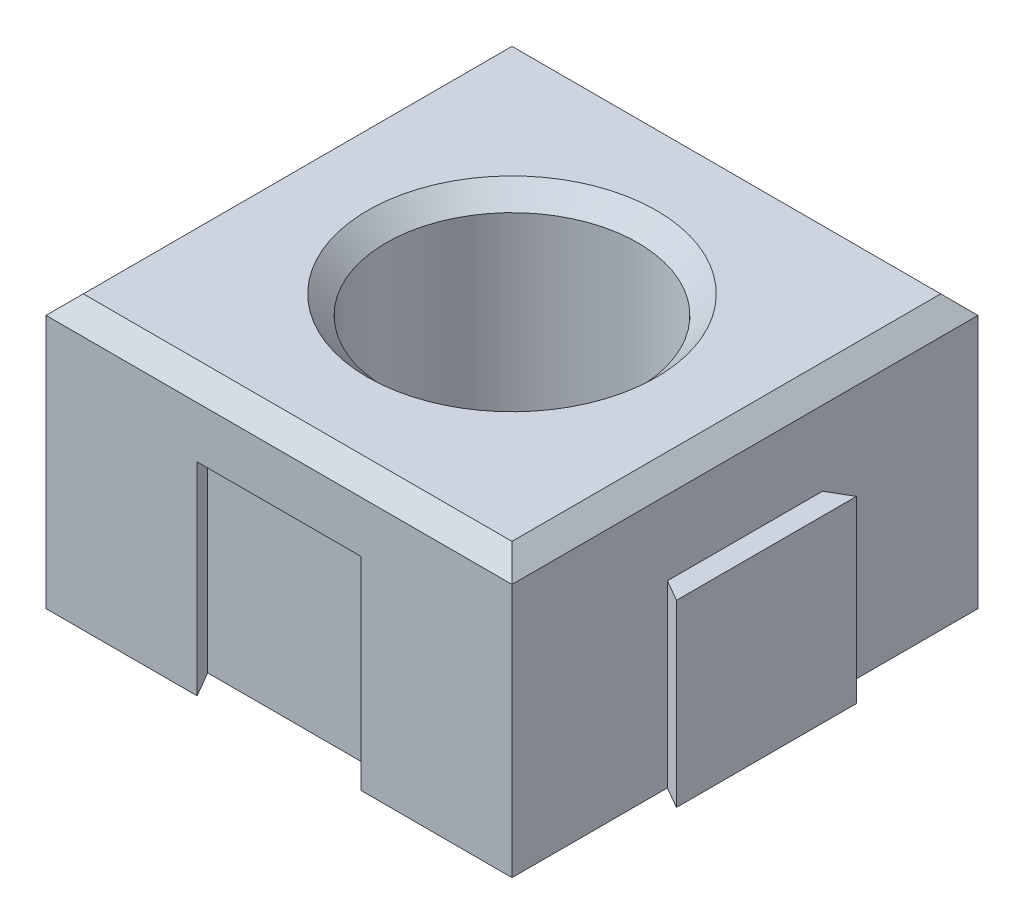
from build123d import *

# Parameters (mm, degrees)
SKETCH1_W           = 50
SKETCH1_H           = 50
BOSS_EXTRUDE1_DEPTH = 30
SKETCH2_R           = 13.5
CUT_EXTRUDE1_DEPTH  = 26
BOSS_EXTRUDE2_DEPTH = 20
BOSS_EXTRUDE3_DEPTH = 20
CUT_EXTRUDE5_DEPTH  = 20
CUT_EXTRUDE6_DEPTH  = 20
CHAMFER1_SIZE       = 2
SKETCH4_R           = 3.1
CUT_EXTRUDE4_DEPTH  = 4
CHAMFER2_SIZE       = 1
CHAMFER3_SIZE       = 0.75
CHAMFER4_SIZE       = 2.5


with BuildPart() as part:
    # Sketch1 → Boss-Extrude1 (new body)
    with BuildSketch(Plane(origin=(0, 0, 0), x_dir=(1, 0, 0), z_dir=(0, 1, 0))):
        with Locations((25, 25)):
            Rectangle(SKETCH1_W, SKETCH1_H)
    extrude(amount=BOSS_EXTRUDE1_DEPTH)

    # Sketch2 → Cut-Extrude1 (cut)
    with BuildSketch(Plane(origin=(0, 30, 0), x_dir=(1, 0, 0), z_dir=(0, 1, 0))):
        with Locations((25, 25)):
            Circle(SKETCH2_R)
    extrude(amount=-CUT_EXTRUDE1_DEPTH, mode=Mode.SUBTRACT)

    # Sketch3 → Boss-Extrude2 (add)
    with BuildSketch(Plane(origin=(0, 0, 0), x_dir=(1, 0, 0), z_dir=(0, 1, 0))):
        Polygon((50, 16.674315781), (50, 33.325684219), (52.3, 34.653589838), (52.3, 15.346410162), align=None)
    extrude(amount=BOSS_EXTRUDE2_DEPTH)

    # Sketch3<3> → Boss-Extrude3 (add)
    with BuildSketch(Plane(origin=(0, 0, 0), x_dir=(1, 0, 0), z_dir=(0, 1, 0))):
        Polygon((33.325684219, 50), (16.674315781, 50), (15.346410162, 52.3), (34.653589838, 52.3), align=None)
    extrude(amount=BOSS_EXTRUDE3_DEPTH)

    # Sketch3<6> → Cut-Extrude5 (cut)
    with BuildSketch(Plane(origin=(0, 0, 0), x_dir=(1, 0, 0), z_dir=(0, 1, 0))):
        Polygon((0, 33.787564435), (2.7, 35.346410162), (2.7, 14.653589838), (0, 16.212435565), align=None)
    extrude(amount=CUT_EXTRUDE5_DEPTH, mode=Mode.SUBTRACT)

    # Sketch3<7> → Cut-Extrude6 (cut)
    with BuildSketch(Plane(origin=(0, 0, 0), x_dir=(1, 0, 0), z_dir=(0, 1, 0))):
        Polygon((16.212435565, 0), (14.653589838, 2.7), (35.346410162, 2.7), (33.787564435, 0), align=None)
    extrude(amount=CUT_EXTRUDE6_DEPTH, mode=Mode.SUBTRACT)

    # Chamfer1
    chamfer1_edges = [part.edges().sort_by_distance(p)[0] for p in [
        (25, 30, -50),
        (50, 30, -25),
        (25, 30, 0),
        (0, 30, -25),
        (11.5, 30, -25),
    ]]
    chamfer(chamfer1_edges, length=CHAMFER1_SIZE)

    # Sketch4 → Cut-Extrude4 (cut)
    with BuildSketch(Plane(origin=(0, 0, 0), x_dir=(1, 0, 0), z_dir=(0, 1, 0))):
        with Locations((12.5, 37.5)):
            Circle(SKETCH4_R)
        with Locations((37.5, 37.5)):
            Circle(SKETCH4_R)
        with Locations((37.5, 12.5)):
            Circle(SKETCH4_R)
        with Locations((12.5, 12.5)):
            Circle(SKETCH4_R)
    extrude(amount=CUT_EXTRUDE4_DEPTH, mode=Mode.SUBTRACT)

    # Chamfer2
    chamfer2_edges = [part.edges().sort_by_distance(p)[0] for p in [
        (34.4, 4, -12.5),
        (9.4, 4, -12.5),
        (9.4, 4, -37.5),
        (34.4, 4, -37.5),
    ]]
    chamfer(chamfer2_edges, length=CHAMFER2_SIZE)

    # Chamfer3
    chamfer3_edges = [part.edges().sort_by_distance(p)[0] for p in [
        (41.893782217, 0, 0),
        (50, 0, -8.33715789),
        (50, 0, -41.66284211),
        (41.66284211, 0, -50),
        (8.33715789, 0, -50),
        (0, 0, -41.893782217),
        (0, 0, -8.106217783),
        (8.106217783, 0, 0),
        (9.4, 0, -37.5),
        (34.4, 0, -37.5),
        (34.4, 0, -12.5),
        (9.4, 0, -12.5),
        (51.15, 0, -16.010362971),
        (52.3, 0, -25),
        (51.15, 0, -33.989637029),
        (33.989637029, 0, -51.15),
        (25, 0, -52.3),
        (16.010362971, 0, -51.15),
        (1.35, 0, -34.566987298),
        (2.7, 0, -25),
        (1.35, 0, -15.433012702),
        (15.433012702, 0, -1.35),
        (25, 0, -2.7),
        (34.566987298, 0, -1.35),
    ]]
    chamfer(chamfer3_edges, length=CHAMFER3_SIZE)

    # Chamfer4
    chamfer4_edges = [part.edges().sort_by_distance(p)[0] for p in [
        (25, 20, 0),
        (0, 20, -25),
    ]]
    chamfer(chamfer4_edges, length=CHAMFER4_SIZE)


solid = part.part
